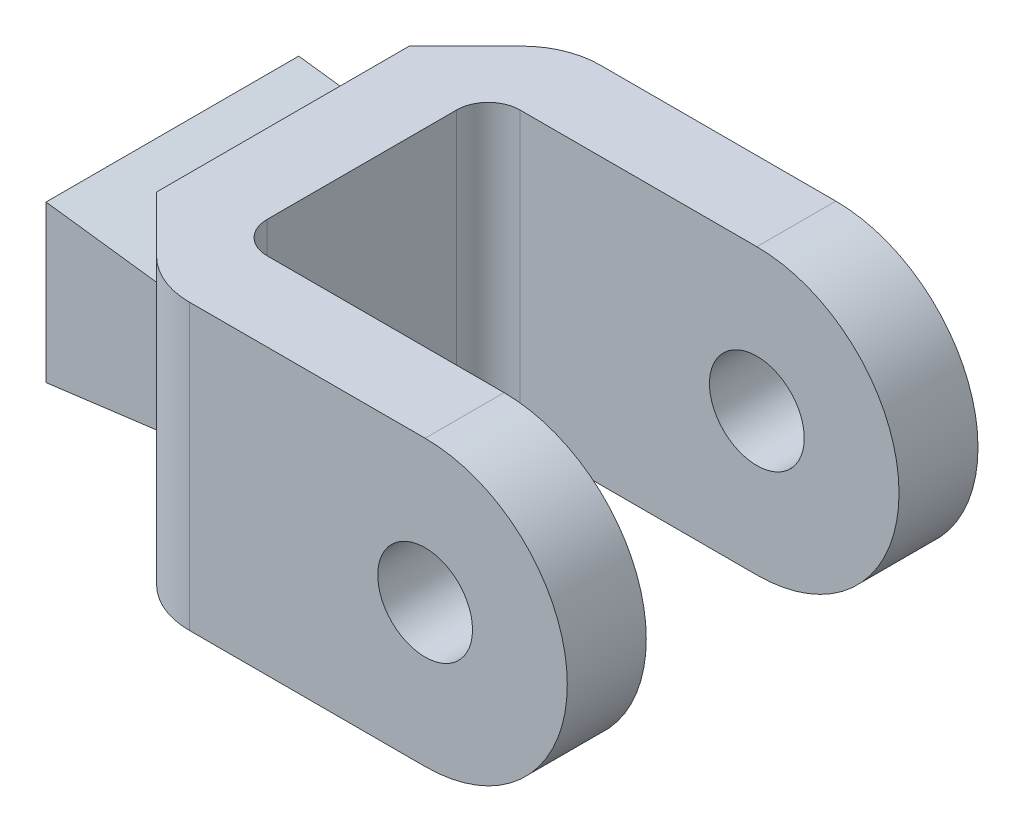
from build123d import *

# Parameters (mm, degrees)
BOSS_EXTRUDE1_DEPTH  = 8
SKETCH2_R            = 1.5
BOSS_EXTRUDE3_DEPTH  = 2.5
CUT_EXTRUDE2_DEPTH   = 20.54002303
FILLET5_R            = 1
FILLET6_R            = 2.5
FILLET5_OF_MIRROR2_R = 1
FILLET6_OF_MIRROR2_R = 2.5


with BuildPart() as part:
    # Sketch1 → Boss-Extrude1 (new body)
    with BuildSketch(Plane.XY):
        Polygon((-1.75, -2.475), (-1.75, 2.475), (1.75, 2.025), (1.75, 4.5), (4.25, 4.5), (4.25, -4.5), (1.75, -4.5), (1.75, -2.025), align=None)
    extrude(amount=BOSS_EXTRUDE1_DEPTH)

    # Sketch2 → Boss-Extrude3 (add)
    with BuildSketch(Plane.XY):
        with BuildLine():
            Line((12.75, -4.5), (1.75, -4.5))
            Line((1.75, -4.5), (1.75, 4.5))
            Line((1.75, 4.5), (12.75, 4.5))
            ThreePointArc((12.75, 4.5), (17.25, 0), (12.75, -4.5))
        make_face()
        with Locations((12.75, 0)):
            Circle(SKETCH2_R, mode=Mode.SUBTRACT)
    boss_extrude3 = extrude(amount=-BOSS_EXTRUDE3_DEPTH)

    # Sketch5 → Cut-Extrude2 (cut, symmetric)
    with BuildSketch(Plane(origin=(0, 0, 0), x_dir=(1, 0, 0), z_dir=(0, 1, 0))):
        Polygon((1.75, 0), (4.25, 2.5), (1.75, 2.5), align=None)
    cut_extrude2 = extrude(amount=CUT_EXTRUDE2_DEPTH, both=True, mode=Mode.SUBTRACT)

    # Fillet5
    fillet5_edges = [part.edges().sort_by_distance(p)[0] for p in [
        (4.25, 0, 0),
    ]]
    fillet(fillet5_edges, radius=FILLET5_R)

    # Fillet6
    fillet6_edges = [part.edges().sort_by_distance(p)[0] for p in [
        (4.25, 0, -2.5),
    ]]
    fillet(fillet6_edges, radius=FILLET6_R)

    # Mirror2: Boss-Extrude3, Cut-Extrude2 across plane
    add(boss_extrude3.mirror(Plane(origin=(0, 0, 4), x_dir=(1, 0, 0), z_dir=(0, 0, -1))))
    add(cut_extrude2.mirror(Plane(origin=(0, 0, 4), x_dir=(1, 0, 0), z_dir=(0, 0, -1))), mode=Mode.SUBTRACT)

    # Fillet5 of Mirror2
    fillet5_of_mirror2_edges = [part.edges().sort_by_distance(p)[0] for p in [
        (4.25, 0, 8),
    ]]
    fillet(fillet5_of_mirror2_edges, radius=FILLET5_OF_MIRROR2_R)

    # Fillet6 of Mirror2
    fillet6_of_mirror2_edges = [part.edges().sort_by_distance(p)[0] for p in [
        (4.25, 0, 10.5),
    ]]
    fillet(fillet6_of_mirror2_edges, radius=FILLET6_OF_MIRROR2_R)


solid = part.part
